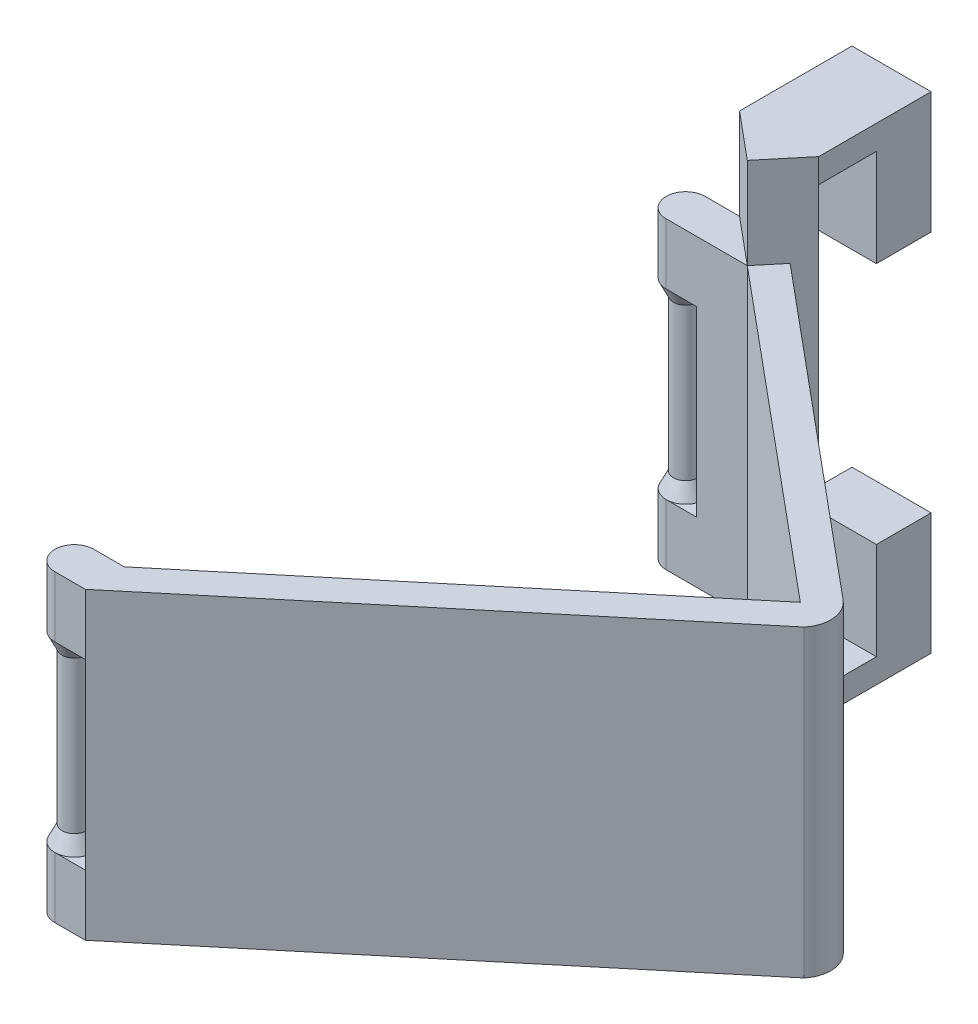
from build123d import *

# Parameters (mm, degrees)
EXTRUDE_1_DEPTH  = 50
EXTRUDE_START    = -50
EXTRUDE_3_DEPTH  = 65
SKETCH_5_W       = 13.017082793
SKETCH_5_H       = 4
EXTRUDE_4_DEPTH  = 18.5
SKETCH_6_W       = 13.017082793
SKETCH_6_H       = 9
EXTRUDE_5_DEPTH  = 16
EXTRUDE_6_DEPTH  = 50
EXTRUDE_7_DEPTH  = 10
EXTRUDE_8_DEPTH  = 10
SKETCH_11_R      = 2
EXTRUDE_9_DEPTH  = 30
SKETCH_15_R      = 2
EXTRUDE_10_DEPTH = 30


with BuildPart() as part:
    # 草图1 → 凸台-拉伸1 (new body)
    with BuildSketch(Plane(origin=(0, 0, 0), x_dir=(1, 0, 0), z_dir=(0, 1, 0))):
        with BuildLine():
            Line((7.810249676, 50), (0, 50))
            Line((0, 50), (60, 0))
            Line((60, 0), (-0.663965605, -50.553304671))
            Line((-0.663965605, -50.553304671), (-0.663965605, -56.955148667))
            Line((-0.663965605, -56.955148667), (63.841106398, -3.200921998))
            ThreePointArc((63.841106398, -3.200921998), (64.979466032, 0.45267873), (63.200921998, 3.841106398))
            Line((63.200921998, 3.841106398), (7.810249676, 50))
        make_face()
    extrude(amount=EXTRUDE_1_DEPTH)

    # 草图4 → 凸台-拉伸3 (add)
    with BuildSketch(Plane(origin=(0, 50, 0), x_dir=(1, 0, 0), z_dir=(0, 1, 0)).offset(EXTRUDE_START)):
        Polygon((0, 50), (7.682212796, 43.598156003), (13.017082793, 50), align=None)
    extrude_3 = extrude(amount=EXTRUDE_3_DEPTH)

    # 草图5 → 凸台-拉伸4 (add)
    with BuildSketch(Plane(origin=(0, 0, -50), x_dir=(-1, 0, 0), z_dir=(0, 0, -1))):
        with Locations((-6.508541397, 63)):
            Rectangle(SKETCH_5_W, SKETCH_5_H)
    extrude_4 = extrude(amount=EXTRUDE_4_DEPTH)

    # 草图6 → 凸台-拉伸5 (add)
    with BuildSketch(Plane.XZ.offset(-61)):
        with Locations((6.508541397, -64)):
            Rectangle(SKETCH_6_W, SKETCH_6_H)
    extrude_5 = extrude(amount=EXTRUDE_5_DEPTH)

    # 镜向4: 凸台-拉伸3, 凸台-拉伸4, 凸台-拉伸5 across plane
    add(extrude_3.mirror(Plane(origin=(0, 25, 0), x_dir=(0, 0, 1), z_dir=(0, -1, 0))))
    add(extrude_4.mirror(Plane(origin=(0, 25, 0), x_dir=(0, 0, 1), z_dir=(0, -1, 0))))
    add(extrude_5.mirror(Plane(origin=(0, 25, 0), x_dir=(0, 0, 1), z_dir=(0, -1, 0))))

    # 草图8 → 凸台-拉伸6 (add)
    with BuildSketch(Plane(origin=(0, 50, 0), x_dir=(1, 0, 0), z_dir=(0, 1, 0))):
        Polygon((7.682212796, 43.598156003), (-0.663965605, 43.598156003), (-0.663965605, 50), (0, 50), align=None)
    extrude(amount=-EXTRUDE_6_DEPTH)

    # 草图9 → 凸台-拉伸7 (add)
    with BuildSketch(Plane.XZ):
        with BuildLine():
            Line((-0.663965605, 50.553304671), (-0.663965605, 56.955148667))
            Line((-0.663965605, 56.955148667), (-5.663965605, 56.955148667))
            ThreePointArc((-5.663965605, 56.955148667), (-8.864887603, 53.754226669), (-5.663965605, 50.553304671))
            Line((-5.663965605, 50.553304671), (-0.663965605, 50.553304671))
        make_face()
    extrude_7 = extrude(amount=-EXTRUDE_7_DEPTH)

    # 草图10 → 凸台-拉伸8 (add)
    with BuildSketch(Plane.XZ):
        with BuildLine():
            Line((-0.663965605, -50), (-0.663965605, -43.598156003))
            Line((-0.663965605, -43.598156003), (-5.663965605, -43.598156003))
            ThreePointArc((-5.663965605, -43.598156003), (-8.864887603, -46.799078002), (-5.663965605, -50))
            Line((-5.663965605, -50), (-0.663965605, -50))
        make_face()
    extrude_8 = extrude(amount=-EXTRUDE_8_DEPTH)

    # 镜向5: 凸台-拉伸7, 凸台-拉伸8 across plane
    add(extrude_7.mirror(Plane(origin=(0, 25, 0), x_dir=(0, 0, 1), z_dir=(0, -1, 0))))
    add(extrude_8.mirror(Plane(origin=(0, 25, 0), x_dir=(0, 0, 1), z_dir=(0, -1, 0))))

    # 草图11 → 凸台-拉伸9 (add)
    with BuildSketch(Plane.XZ.offset(-40)):
        with Locations((-5.663965605, 53.754226669)):
            Circle(SKETCH_11_R)
    extrude(amount=EXTRUDE_9_DEPTH)

    # 草图14 → 旋转1 (revolve)
    with BuildSketch(Plane(origin=(0, 0, 53.754226669), x_dir=(-1, 0, 0), z_dir=(0, 0, -1))):
        Polygon((7.663965605, 12.5), (7.663965605, 10), (8.864887603, 10), align=None)
    revolve_1 = revolve(axis=Axis((-5.663965605, 10, 53.754226669), (0, 1, 0)))

    # 镜向6: 旋转1 across plane
    add(revolve_1.mirror(Plane(origin=(0, 25, 0), x_dir=(0, 0, 1), z_dir=(0, -1, 0))))

    # 草图15 → 凸台-拉伸10 (add)
    with BuildSketch(Plane(origin=(0, 10, 0), x_dir=(1, 0, 0), z_dir=(0, 1, 0))):
        with Locations((-5.663965605, 46.799078002)):
            Circle(SKETCH_15_R)
    extrude(amount=EXTRUDE_10_DEPTH)

    # 草图17 → 旋转2 (revolve)
    with BuildSketch(Plane.XY.offset(-46.799078002)):
        Polygon((-7.663965605, 10), (-7.663965605, 12.5), (-8.864887603, 10), align=None)
    revolve_2 = revolve(axis=Axis((-5.663965605, 40, -46.799078002), (0, -1, 0)))

    # 镜向7: 旋转2 across plane
    add(revolve_2.mirror(Plane(origin=(0, 25, 0), x_dir=(0, 0, 1), z_dir=(0, -1, 0))))


solid = part.part
